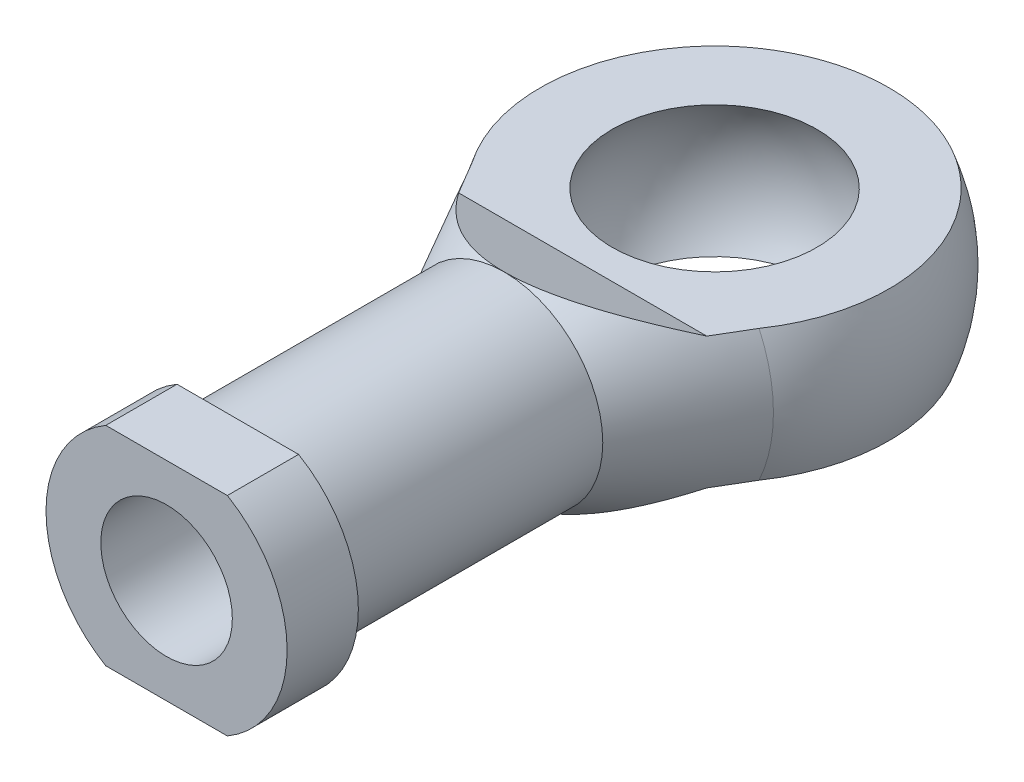
from build123d import *

# Parameters (mm, degrees)
WYTNIJ_WYCI_GNI_CIE1_DEPTH      = 56.479726027
WYTNIJ_WYCI_GNI_CIE1_DEPTH_BACK = 56.479726027
SZKIC3_R                        = 6
WYTNIJ_WYCI_GNI_CIE2_DEPTH      = 22


with BuildPart() as part:
    # Szkic1 → Obrót1 (revolve)
    with BuildSketch(Plane(origin=(0, 0, 0), x_dir=(1, 0, 0), z_dir=(0, 1, 0))):
        with BuildLine():
            Line((0, 17), (0, -50))
            Line((0, -50), (-11, -50))
            Line((-11, -50), (-11, -43.5))
            Line((-11, -43.5), (-9, -43.5))
            Line((-9, -43.5), (-9, -19.2))
            Line((-9, -19.2), (-14.40224282, -9.031910194))
            ThreePointArc((-14.40224282, -9.031910194), (-14.875188626, 8.229748681), (0, 17))
        make_face()
    revolve(axis=Axis((0, 0, -17), (0, 0, 1)))

    # Szkic2 → Wytnij-wyciągnięcie1 (cut, two sides: drawn at the far end of the back side and taken through both)
    with BuildSketch(Plane(origin=(0, 0, 0), x_dir=(0, 0, -1), z_dir=(1, 0, 0)).offset(-WYTNIJ_WYCI_GNI_CIE1_DEPTH_BACK)):
        Polygon((-20.394523488, 9.5), (-12.032859072, 6), (29.066011649, 6), (29.066011649, 24.437444977), (-60.273702568, 24.437444977), (-60.273702568, 9.5), align=None)
        Polygon((29.066011649, -24.437444977), (29.066011649, -6), (-12.032859072, -6), (-20.394523488, -9.5), (-60.273702568, -9.5), (-60.273702568, -24.437444977), align=None)
    extrude(amount=WYTNIJ_WYCI_GNI_CIE1_DEPTH + WYTNIJ_WYCI_GNI_CIE1_DEPTH_BACK, mode=Mode.SUBTRACT)

    # Szkic3 → Wytnij-wyciągnięcie2 (cut)
    with BuildSketch(Plane.XY.offset(50)):
        Circle(SZKIC3_R)
    extrude(amount=-WYTNIJ_WYCI_GNI_CIE2_DEPTH, mode=Mode.SUBTRACT)

    # Szkic5 → Wycięcie-obrót1 (revolve, cut)
    with BuildSketch(Plane.XY):
        with BuildLine():
            Line((0, -11.1), (0, 11.1))
            ThreePointArc((0, 11.1), (-11.1, 0), (0, -11.1))
        make_face()
    revolve(axis=Axis((0, -11.1, 0), (0, 1, 0)), mode=Mode.SUBTRACT)


solid = part.part
